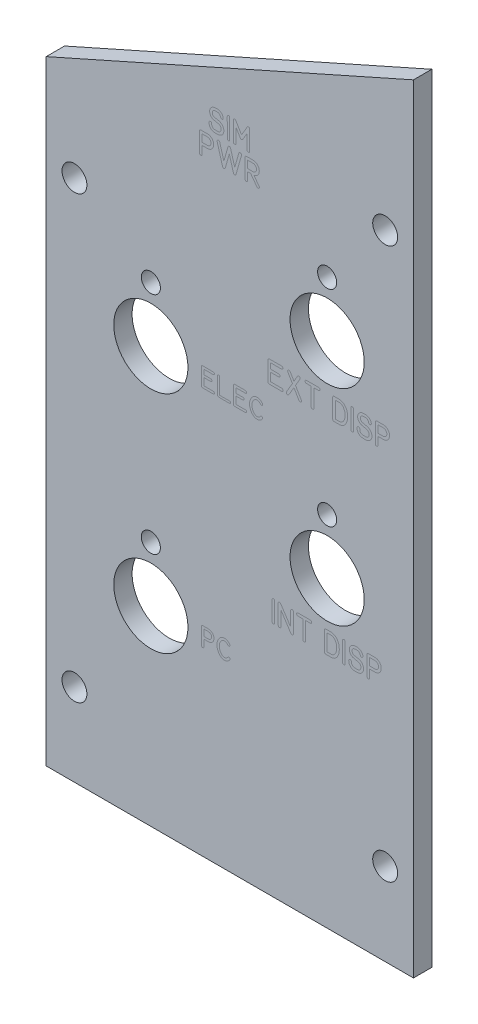
from build123d import *

# Parameters (mm, degrees)
BOSS_EXTRUDE1_DEPTH   = 3.175
SKETCH2_R             = 6.4135
SKETCH2_R_2           = 1.651
CUT_EXTRUDE1_DEPTH    = 151.327221464
F_6_CLEARANCE_HOLE1_D = 4.3053
CUT_EXTRUDE2_DEPTH    = 151.327221464


with BuildPart() as part:
    # Sketch1 → Boss-Extrude1 (new body)
    with BuildSketch(Plane.XY):
        Polygon((0, 107.95), (0, 0), (63.5, 0), (63.5, 136.2202), align=None)
    extrude(amount=-BOSS_EXTRUDE1_DEPTH)

    # Sketch2 → Cut-Extrude1 (cut, through all)
    with BuildSketch(Plane.XY):
        with Locations((48.5775, 52.3875)):
            Circle(SKETCH2_R)
        with Locations((48.5775, 61.9125)):
            Circle(SKETCH2_R_2)
        with Locations((48.5775, 87.9475)):
            Circle(SKETCH2_R)
        with Locations((48.5775, 97.4725)):
            Circle(SKETCH2_R_2)
        with Locations((18.0975, 81.43875)):
            Circle(SKETCH2_R_2)
        with Locations((18.0975, 71.91375)):
            Circle(SKETCH2_R)
        with Locations((18.0975, 42.545)):
            Circle(SKETCH2_R_2)
        with Locations((18.0975, 33.02)):
            Circle(SKETCH2_R)
    extrude(amount=-CUT_EXTRUDE1_DEPTH, mode=Mode.SUBTRACT)

    # #6 Clearance Hole1 (through all)
    with Locations(Plane.XY):
        with Locations((58.6105, 14.2875), (4.8895, 14.2875), (4.8895, 90.4875), (58.6105, 109.5375)):
            Hole(F_6_CLEARANCE_HOLE1_D / 2)

    # Sketch6 → Cut-Extrude2 (cut, through all)
    with BuildSketch(Plane.XY):
        Polygon((63.5, 136.2202), (0, 107.95), (0, 106.212283429), (63.5, 134.482483429), align=None)
    extrude(amount=-CUT_EXTRUDE2_DEPTH, mode=Mode.SUBTRACT)


solid = part.part
